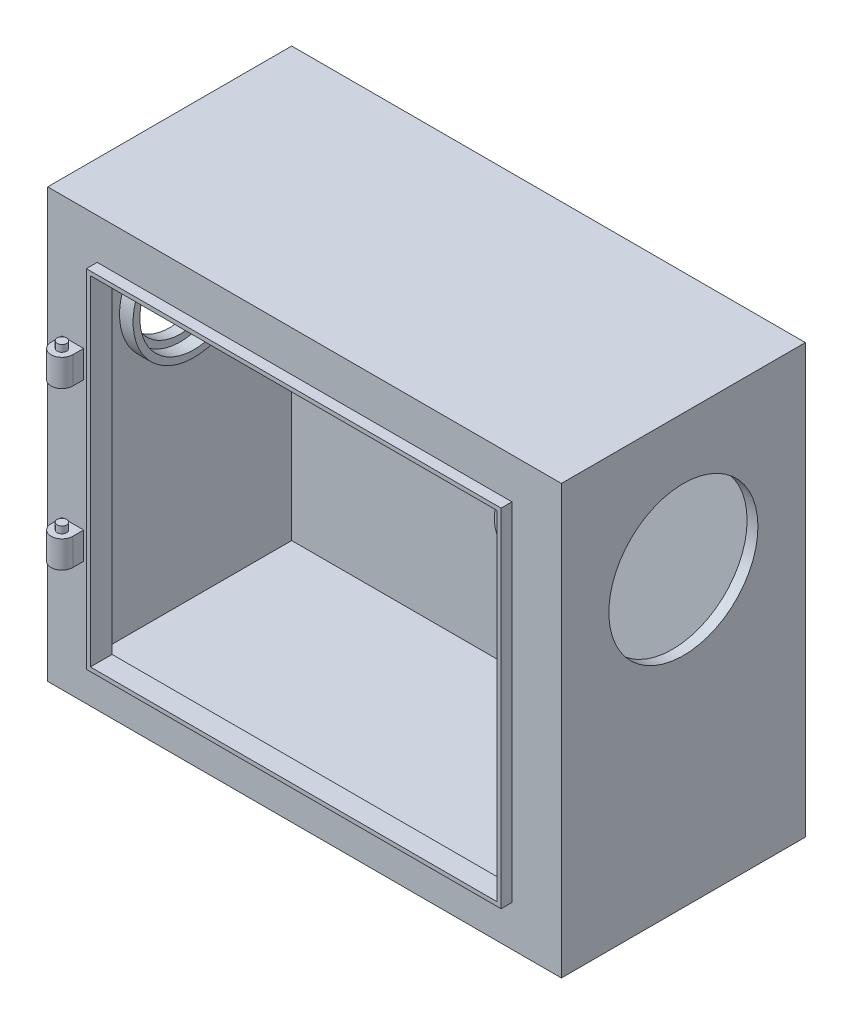
from build123d import *

# Parameters (mm, degrees)
CROQUIS1_W               = 379
CROQUIS1_H               = 316
SALIENTE_EXTRUIR1_DEPTH  = 180
VACIADO1_T               = -8
CROQUIS2_R               = 35
CORTAR_EXTRUIR4_DEPTH    = 20
CROQUIS4_R               = 45
CROQUIS4_R_2             = 40
SALIENTE_EXTRUIR4_DEPTH  = 10
CROQUIS6_R               = 55
CORTAR_EXTRUIR6_DEPTH    = 10
CROQUIS7_R               = 24
CROQUIS7_R_2             = 21
SALIENTE_EXTRUIR9_DEPTH  = 8
CROQUIS11_W              = 363
CROQUIS11_H              = 300
CROQUIS11_W_2            = 300
CROQUIS11_H_2            = 250
SALIENTE_EXTRUIR10_DEPTH = 8
CROQUIS12_W              = 306
CROQUIS12_H              = 256
CROQUIS12_W_2            = 300
CROQUIS12_H_2            = 250
SALIENTE_EXTRUIR11_DEPTH = 8
CROQUIS13_W              = 16
CROQUIS13_H              = 20
SALIENTE_EXTRUIR13_DEPTH = 8
SALIENTE_EXTRUIR14_DEPTH = 20
CROQUIS15_R              = 3.5
SALIENTE_EXTRUIR15_DEPTH = 5
CROQUIS17_W              = 16
CROQUIS17_H              = 20
SALIENTE_EXTRUIR16_DEPTH = 8
SALIENTE_EXTRUIR17_DEPTH = 20
CROQUIS19_R              = 3.5
SALIENTE_EXTRUIR18_DEPTH = 5


with BuildPart() as part:
    # Croquis1 → Saliente-Extruir1 (new body)
    with BuildSketch(Plane.XY):
        Rectangle(CROQUIS1_W, CROQUIS1_H)
    extrude(amount=SALIENTE_EXTRUIR1_DEPTH)

    # Vaciado1
    vaciado1_openings = [part.faces().sort_by_distance(p)[0] for p in [
        (0, 0, 180),
    ]]
    offset(amount=VACIADO1_T, openings=vaciado1_openings, kind=Kind.INTERSECTION)

    # Croquis2 → Cortar-Extruir4 (cut)
    with BuildSketch(Plane.ZY.offset(189.5)):
        with Locations((90, 58)):
            Circle(CROQUIS2_R)
    extrude(amount=-CORTAR_EXTRUIR4_DEPTH, mode=Mode.SUBTRACT)

    # Croquis4 → Saliente-Extruir4 (add)
    with BuildSketch(Plane(origin=(-181.5, 0, 0), x_dir=(0, 0, -1), z_dir=(1, 0, 0))):
        with Locations((-90, 58)):
            Circle(CROQUIS4_R)
        with Locations((-90, 58)):
            Circle(CROQUIS4_R_2, mode=Mode.SUBTRACT)
    extrude(amount=SALIENTE_EXTRUIR4_DEPTH)

    # Croquis6 → Cortar-Extruir6 (cut)
    with BuildSketch(Plane(origin=(189.5, 0, 0), x_dir=(0, 0, -1), z_dir=(1, 0, 0))):
        with Locations((-90, 58)):
            Circle(CROQUIS6_R)
    extrude(amount=-CORTAR_EXTRUIR6_DEPTH, mode=Mode.SUBTRACT)

    # Croquis7 → Saliente-Extruir9 (add)
    with BuildSketch(Plane.XY.offset(8)):
        with Locations((0, -53)):
            Circle(CROQUIS7_R)
        with Locations((0, -53)):
            Circle(CROQUIS7_R_2, mode=Mode.SUBTRACT)
    extrude(amount=SALIENTE_EXTRUIR9_DEPTH)

    # Croquis11 → Saliente-Extruir10 (add)
    with BuildSketch(Plane.XY.offset(180)):
        Rectangle(CROQUIS11_W, CROQUIS11_H)
        Rectangle(CROQUIS11_W_2, CROQUIS11_H_2, mode=Mode.SUBTRACT)
    extrude(amount=-SALIENTE_EXTRUIR10_DEPTH)

    # Croquis12 → Saliente-Extruir11 (add)
    with BuildSketch(Plane.XY.offset(180)):
        Rectangle(CROQUIS12_W, CROQUIS12_H)
        Rectangle(CROQUIS12_W_2, CROQUIS12_H_2, mode=Mode.SUBTRACT)
    extrude(amount=SALIENTE_EXTRUIR11_DEPTH)

    # Croquis13 → Saliente-Extruir13 (add)
    with BuildSketch(Plane.XY.offset(180)):
        with Locations((-171, 58)):
            Rectangle(CROQUIS13_W, CROQUIS13_H)
    extrude(amount=SALIENTE_EXTRUIR13_DEPTH)

    # Croquis14 → Saliente-Extruir14 (add)
    with BuildSketch(Plane(origin=(0, 68, 0), x_dir=(1, 0, 0), z_dir=(0, 1, 0))):
        with BuildLine():
            Line((-179, -188), (-163, -188))
            ThreePointArc((-163, -188), (-171, -196), (-179, -188))
        make_face()
    extrude(amount=-SALIENTE_EXTRUIR14_DEPTH)

    # Croquis15 → Saliente-Extruir15 (add)
    with BuildSketch(Plane(origin=(0, 68, 0), x_dir=(1, 0, 0), z_dir=(0, 1, 0))):
        with Locations((-171, -188)):
            Circle(CROQUIS15_R)
    extrude(amount=SALIENTE_EXTRUIR15_DEPTH)

    # Croquis17 → Saliente-Extruir16 (add)
    with BuildSketch(Plane.XY.offset(180)):
        with Locations((-171, -58)):
            Rectangle(CROQUIS17_W, CROQUIS17_H)
    extrude(amount=SALIENTE_EXTRUIR16_DEPTH)

    # Croquis18 → Saliente-Extruir17 (add)
    with BuildSketch(Plane(origin=(0, -48, 0), x_dir=(1, 0, 0), z_dir=(0, 1, 0))):
        with BuildLine():
            Line((-179, -188), (-163, -188))
            ThreePointArc((-163, -188), (-171, -196), (-179, -188))
        make_face()
    extrude(amount=-SALIENTE_EXTRUIR17_DEPTH)

    # Croquis19 → Saliente-Extruir18 (add)
    with BuildSketch(Plane(origin=(0, -48, 0), x_dir=(1, 0, 0), z_dir=(0, 1, 0))):
        with Locations((-171, -188)):
            Circle(CROQUIS19_R)
    extrude(amount=SALIENTE_EXTRUIR18_DEPTH)


solid = part.part
